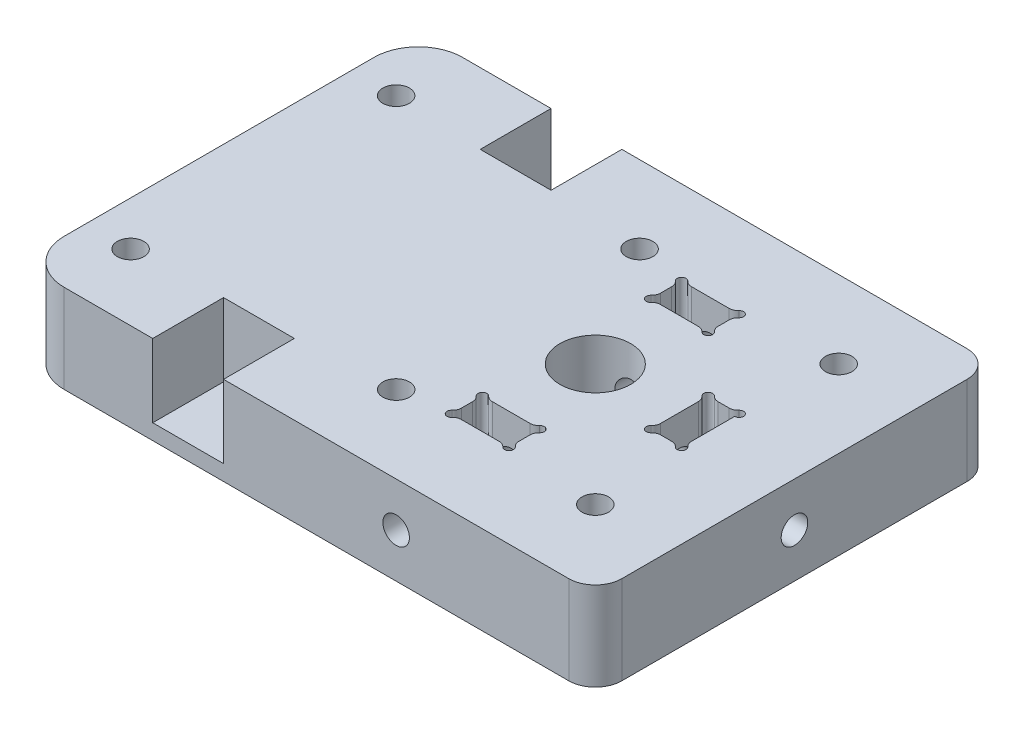
from build123d import *

# Parameters (mm, degrees)
SKETCH1_R             = 4
SKETCH1_R_2           = 1.5
BOSS_EXTRUDE1_DEPTH   = 10
FILLET1_R             = 3
FILLET2_R             = 1
CUT_EXTRUDE1_DEPTH    = 24
CIRPATTERN1_OUTLINE_R = 1.5
CIRPATTERN1_DEPTH     = 45
SKETCH3_W             = 15
SKETCH3_H             = 45
SKETCH3_R             = 1.5
BOSS_EXTRUDE2_DEPTH   = 10
FILLET3_R             = 5
SKETCH4_R             = 3.25
CUT_EXTRUDE2_DEPTH    = 3
SKETCH5_W             = 8
SKETCH5_H             = 8
BOSS_EXTRUDE3_DEPTH   = 1.75


# Read off the part's stored shape, not the designer's step: CirPattern1
with BuildPart() as part:
    # Sketch1 → Boss-Extrude1 (new body)
    with BuildSketch(Plane(origin=(0, 0, 0), x_dir=(1, 0, 0), z_dir=(0, 1, 0))):
        Polygon((0, 0), (-42, 0), (-42, -8), (-50, -8), (-50, -37), (-42, -37), (-42, -45), (0, -45), align=None)
        with Locations(Location((-22.5, -22.5, 0), (0, 0, 270))):
            Circle(SKETCH1_R, mode=Mode.SUBTRACT)
        with BuildLine():
            Line((-19.75, -13), (-25.25, -13))
            ThreePointArc((-25.25, -13), (-26.103553391, -13.353553391), (-25.75, -12.5))
            Line((-25.75, -12.5), (-25.75, -10))
            ThreePointArc((-25.75, -10), (-26.103553391, -9.146446609), (-25.25, -9.5))
            Line((-25.25, -9.5), (-19.75, -9.5))
            ThreePointArc((-19.75, -9.5), (-18.896446609, -9.146446609), (-19.25, -10))
            Line((-19.25, -10), (-19.25, -12.5))
            ThreePointArc((-19.25, -12.5), (-18.896446609, -13.353553391), (-19.75, -13))
        make_face(mode=Mode.SUBTRACT)
        with Locations(Location((-31.25, -8.75, 0), (0, 0, 270))):
            Circle(SKETCH1_R_2, mode=Mode.SUBTRACT)
        with Locations(Location((-31.25, -36.25, 0), (0, 0, 270))):
            Circle(SKETCH1_R_2, mode=Mode.SUBTRACT)
        with Locations(Location((-8.75, -36.25, 0), (0, 0, 270))):
            Circle(SKETCH1_R_2, mode=Mode.SUBTRACT)
        with Locations(Location((-8.75, -8.75, 0), (0, 0, 270))):
            Circle(SKETCH1_R_2, mode=Mode.SUBTRACT)
        with BuildLine():
            Line((-9.5, -19.75), (-9.5, -25.25))
            ThreePointArc((-9.5, -25.25), (-9.146446609, -26.103553391), (-10, -25.75))
            Line((-10, -25.75), (-12.5, -25.75))
            ThreePointArc((-12.5, -25.75), (-13.353553391, -26.103553391), (-13, -25.25))
            Line((-13, -25.25), (-13, -19.75))
            ThreePointArc((-13, -19.75), (-13.353553391, -18.896446609), (-12.5, -19.25))
            Line((-12.5, -19.25), (-10, -19.25))
            ThreePointArc((-10, -19.25), (-9.146446609, -18.896446609), (-9.5, -19.75))
        make_face(mode=Mode.SUBTRACT)
        with BuildLine():
            ThreePointArc((-19.25, -35), (-18.896446609, -35.853553391), (-19.75, -35.5))
            Line((-19.75, -35.5), (-25.25, -35.5))
            ThreePointArc((-25.25, -35.5), (-26.103553391, -35.853553391), (-25.75, -35))
            Line((-25.75, -35), (-25.75, -32.5))
            ThreePointArc((-25.75, -32.5), (-26.103553391, -31.646446609), (-25.25, -32))
            Line((-25.25, -32), (-19.75, -32))
            ThreePointArc((-19.75, -32), (-18.896446609, -31.646446609), (-19.25, -32.5))
            Line((-19.25, -32.5), (-19.25, -35))
        make_face(mode=Mode.SUBTRACT)
    extrude(amount=BOSS_EXTRUDE1_DEPTH)

    # Fillet1
    fillet1_edges = [part.edges().sort_by_distance(p)[0] for p in [
        (0, 5, 45),
        (0, 5, 0),
    ]]
    fillet(fillet1_edges, radius=FILLET1_R)

    # Fillet2
    fillet2_edges = [part.edges().sort_by_distance(p)[0] for p in [
        (-25.75, 5, 32.5),
        (-25.75, 5, 35),
        (-25.25, 5, 35.5),
        (-19.75, 5, 35.5),
        (-19.25, 5, 35),
        (-19.25, 5, 32.5),
        (-19.75, 5, 32),
        (-25.25, 5, 32),
        (-19.25, 5, 12.5),
        (-19.25, 5, 10),
        (-19.75, 5, 9.5),
        (-25.25, 5, 9.5),
        (-25.75, 5, 10),
        (-25.75, 5, 12.5),
        (-25.25, 5, 13),
        (-19.75, 5, 13),
        (-10, 5, 19.25),
        (-12.5, 5, 19.25),
        (-13, 5, 19.75),
        (-13, 5, 25.25),
        (-12.5, 5, 25.75),
        (-10, 5, 25.75),
        (-9.5, 5, 25.25),
    ]]
    fillet(fillet2_edges, radius=FILLET2_R)

    # Sketch2 → Cut-Extrude1 (cut)
    with BuildSketch(Plane(origin=(0, 0, 0), x_dir=(0, 0, -1), z_dir=(1, 0, 0))):
        with BuildLine():
            ThreePointArc((-21, 5), (-21.439339828, 6.060660172), (-22.5, 6.5))
            Line((-22.5, 6.5), (-22.5, 3.5))
            ThreePointArc((-22.5, 3.5), (-21.439339828, 3.939339828), (-21, 5))
        make_face()
        with BuildLine():
            Line((-22.5, 3.5), (-22.5, 6.5))
            ThreePointArc((-22.5, 6.5), (-24, 5), (-22.5, 3.5))
        make_face()
    extrude(amount=-CUT_EXTRUDE1_DEPTH, mode=Mode.SUBTRACT)

    # CirPattern1 outline → CirPattern1 (cut)
    with BuildSketch(Plane.XY):
        with Locations((-22.5, 5)):
            Circle(CIRPATTERN1_OUTLINE_R)
    extrude(amount=CIRPATTERN1_DEPTH, mode=Mode.SUBTRACT)

    # Sketch3 → Boss-Extrude2 (add)
    with BuildSketch(Plane(origin=(0, 10, 0), x_dir=(1, 0, 0), z_dir=(0, 1, 0))):
        with Locations((-57.5, -22.5)):
            Rectangle(SKETCH3_W, SKETCH3_H)
        with Locations(Location((-60, -37.5, 0), (0, 0, 270))):
            Circle(SKETCH3_R, mode=Mode.SUBTRACT)
        with Locations(Location((-60, -7.5, 0), (0, 0, 270))):
            Circle(SKETCH3_R, mode=Mode.SUBTRACT)
    extrude(amount=-BOSS_EXTRUDE2_DEPTH)

    # Fillet3
    fillet3_edges = [part.edges().sort_by_distance(p)[0] for p in [
        (-65, 5, 0),
        (-65, 5, 45),
    ]]
    fillet(fillet3_edges, radius=FILLET3_R)

    # Sketch4 → Cut-Extrude2 (cut)
    with BuildSketch(Plane.XZ):
        with Locations(Location((-31.25, 36.25, 0), (0, 0, 270))):
            Circle(SKETCH4_R)
        with Locations(Location((-8.75, 36.25, 0), (0, 0, 270))):
            Circle(SKETCH4_R)
        with Locations(Location((-8.75, 8.75, 0), (0, 0, 270))):
            Circle(SKETCH4_R)
        with Locations(Location((-31.25, 8.75, 0), (0, 0, 270))):
            Circle(SKETCH4_R)
        with Locations(Location((-60, 37.5, 0), (0, 0, 270))):
            Circle(SKETCH4_R)
        with Locations(Location((-60, 7.5, 0), (0, 0, 270))):
            Circle(SKETCH4_R)
    extrude(amount=-CUT_EXTRUDE2_DEPTH, mode=Mode.SUBTRACT)

    # Sketch5 → Boss-Extrude3 (add)
    with BuildSketch(Plane.XZ):
        with Locations((-46, 41)):
            Rectangle(SKETCH5_W, SKETCH5_H)
        with Locations((-46, 4)):
            Rectangle(SKETCH5_W, SKETCH5_H)
    extrude(amount=-BOSS_EXTRUDE3_DEPTH)


solid = part.part
